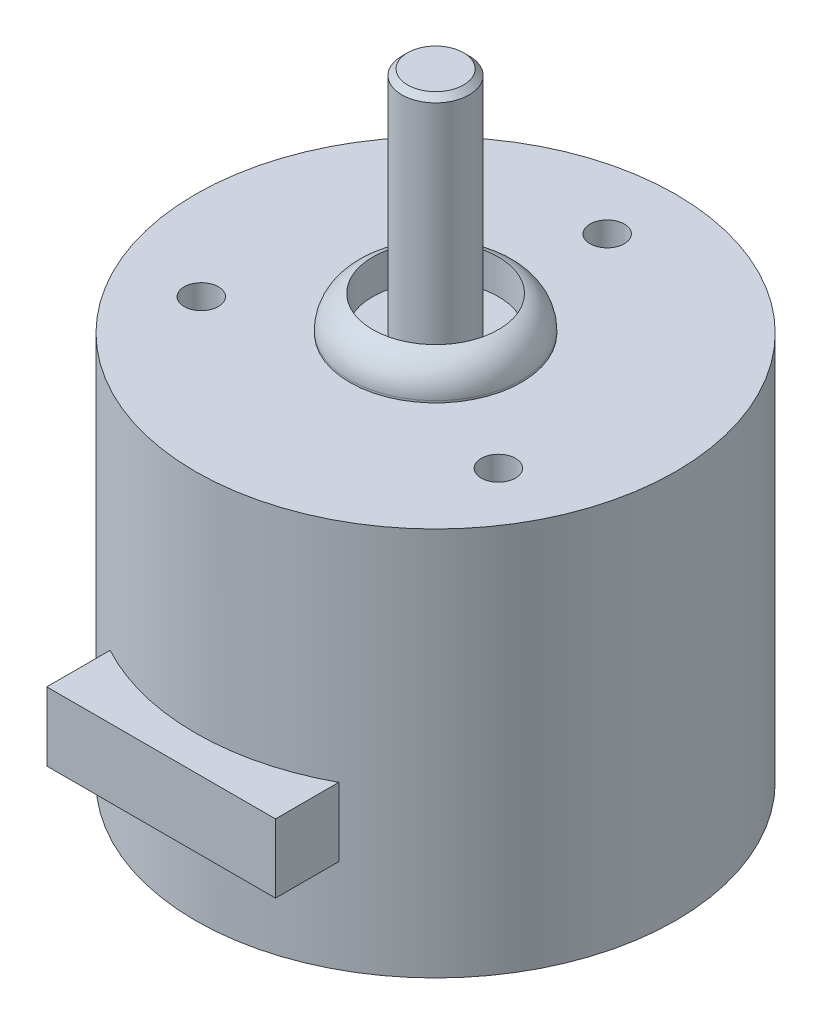
from build123d import *

# Parameters (mm, degrees)
SKETCH1_R           = 21
SKETCH1_R_2         = 1.5
SKETCH1_R_3         = 7.5
SKETCH1_R_4         = 5.5
SKETCH1_R_5         = 2.945
BOSS_EXTRUDE1_DEPTH = 17
CUT_EXTRUDE1_START  = 17
SKETCH1_3_R         = 1.5
CUT_EXTRUDE1_DEPTH  = 10
BOSS_EXTRUDE2_START = 17
SKETCH1_4_R         = 7.5
SKETCH1_4_R_2       = 5.5
BOSS_EXTRUDE2_DEPTH = 3
FILLET1_R           = 3
BOSS_EXTRUDE3_START = 17
SKETCH1_5_R         = 2.945
BOSS_EXTRUDE3_DEPTH = 20
BOSS_EXTRUDE4_START = -2.8
BOSS_EXTRUDE4_DEPTH = 6
CHAMFER1_SIZE       = 0.5


with BuildPart() as part:
    # Sketch1 → Boss-Extrude1 (new, symmetric)
    # profile 1 of 7: a face of its own
    with BuildSketch(Plane(origin=(0, 0, 0), x_dir=(1, 0, 0), z_dir=(0, 1, 0))):
        with Locations(Location((0, 0, 0), (0, 0, 270))):
            Circle(SKETCH1_R)
        with Locations((12.990381057, -7.5)):
            Circle(SKETCH1_R_2, mode=Mode.SUBTRACT)
        with Locations((-12.990381057, -7.5)):
            Circle(SKETCH1_R_2, mode=Mode.SUBTRACT)
        with Locations((0, 15)):
            Circle(SKETCH1_R_2, mode=Mode.SUBTRACT)
        Circle(SKETCH1_R_3, mode=Mode.SUBTRACT)
    # profile 2 of 7: a face of its own
    with BuildSketch(Plane(origin=(0, 0, 0), x_dir=(1, 0, 0), z_dir=(0, 1, 0))):
        Circle(SKETCH1_R_3)
        Circle(SKETCH1_R_4, mode=Mode.SUBTRACT)
    # profile 3 of 7: a face of its own
    with BuildSketch(Plane(origin=(0, 0, 0), x_dir=(1, 0, 0), z_dir=(0, 1, 0))):
        Circle(SKETCH1_R_4)
        Circle(SKETCH1_R_5, mode=Mode.SUBTRACT)
    # profile 4 of 7: a face of its own
    with BuildSketch(Plane(origin=(0, 0, 0), x_dir=(1, 0, 0), z_dir=(0, 1, 0))):
        Circle(SKETCH1_R_5)
    # profile 5 of 7: a face of its own
    with BuildSketch(Plane(origin=(0, 0, 0), x_dir=(1, 0, 0), z_dir=(0, 1, 0))):
        with Locations((-12.990381057, -7.5)):
            Circle(SKETCH1_R_2)
    # profile 6 of 7: a face of its own
    with BuildSketch(Plane(origin=(0, 0, 0), x_dir=(1, 0, 0), z_dir=(0, 1, 0))):
        with Locations((12.990381057, -7.5)):
            Circle(SKETCH1_R_2)
    # profile 7 of 7: a face of its own
    with BuildSketch(Plane(origin=(0, 0, 0), x_dir=(1, 0, 0), z_dir=(0, 1, 0))):
        with Locations((0, 15)):
            Circle(SKETCH1_R_2)
    extrude(amount=BOSS_EXTRUDE1_DEPTH, both=True)

    # Sketch1<3> → Cut-Extrude1 (cut)
    with BuildSketch(Plane(origin=(0, 0, 0), x_dir=(1, 0, 0), z_dir=(0, 1, 0)).offset(CUT_EXTRUDE1_START)):
        with Locations(Location((-12.990381057, -7.5, 0), (0, 0, 270))):
            Circle(SKETCH1_3_R)
        with Locations(Location((12.990381057, -7.5, 0), (0, 0, 270))):
            Circle(SKETCH1_3_R)
        with Locations(Location((0, 15, 0), (0, 0, 270))):
            Circle(SKETCH1_3_R)
    extrude(amount=-CUT_EXTRUDE1_DEPTH, mode=Mode.SUBTRACT)

    # Sketch1<4> → Boss-Extrude2 (add)
    with BuildSketch(Plane(origin=(0, 0, 0), x_dir=(1, 0, 0), z_dir=(0, 1, 0)).offset(BOSS_EXTRUDE2_START)):
        with Locations(Location((0, 0, 0), (0, 0, 270))):
            Circle(SKETCH1_4_R)
        with Locations(Location((0, 0, 0), (0, 0, 270))):
            Circle(SKETCH1_4_R_2, mode=Mode.SUBTRACT)
    extrude(amount=BOSS_EXTRUDE2_DEPTH)

    # Fillet1
    # the kernel refuses this fillet: 3 mm, written as the material it takes off along each edge
    with BuildSketch(Plane(origin=(0, 20, 0), x_dir=(0, 0, 1), z_dir=(-1, 0, 0))) as fillet1_piece_1:
        with BuildLine():
            CenterArc((4.5, -2.828427125), FILLET1_R, 0, 70.528779366)
            Line((5.5, 0), (5.52, 0.056568542))
            ThreePointArc((5.52, 0.056568542), (6.5, 0.06), (7.5, 0.06))
            Line((7.5, 0.06), (7.56, 0))
            Line((7.56, 0), (7.56, -2.828427125))
            Line((7.56, -2.828427125), (7.5, -2.828427125))
        make_face()
    revolve(axis=Axis((0, 20, 0), (0, 1, 0)), mode=Mode.SUBTRACT)

    # Sketch1<5> → Boss-Extrude3 (add)
    with BuildSketch(Plane(origin=(0, 0, 0), x_dir=(1, 0, 0), z_dir=(0, 1, 0)).offset(BOSS_EXTRUDE3_START)):
        with Locations(Location((0, 0, 0), (0, 0, 270))):
            Circle(SKETCH1_5_R)
    extrude(amount=BOSS_EXTRUDE3_DEPTH)

    # Sketch1<8> → Boss-Extrude4 (add)
    with BuildSketch(Plane(origin=(0, 0, 0), x_dir=(1, 0, 0), z_dir=(0, 1, 0)).offset(BOSS_EXTRUDE4_START)):
        with BuildLine():
            ThreePointArc((10, -18.466185313), (0, -21), (-10, -18.466185313))
            Line((-10, -18.466185313), (-10, -24))
            Line((-10, -24), (10, -24))
            Line((10, -24), (10, -18.466185313))
        make_face()
    extrude(amount=-BOSS_EXTRUDE4_DEPTH)

    # Chamfer1
    chamfer1_edges = [part.edges().sort_by_distance(p)[0] for p in [
        (0, 37, -2.945),
    ]]
    chamfer(chamfer1_edges, length=CHAMFER1_SIZE)


solid = part.part
